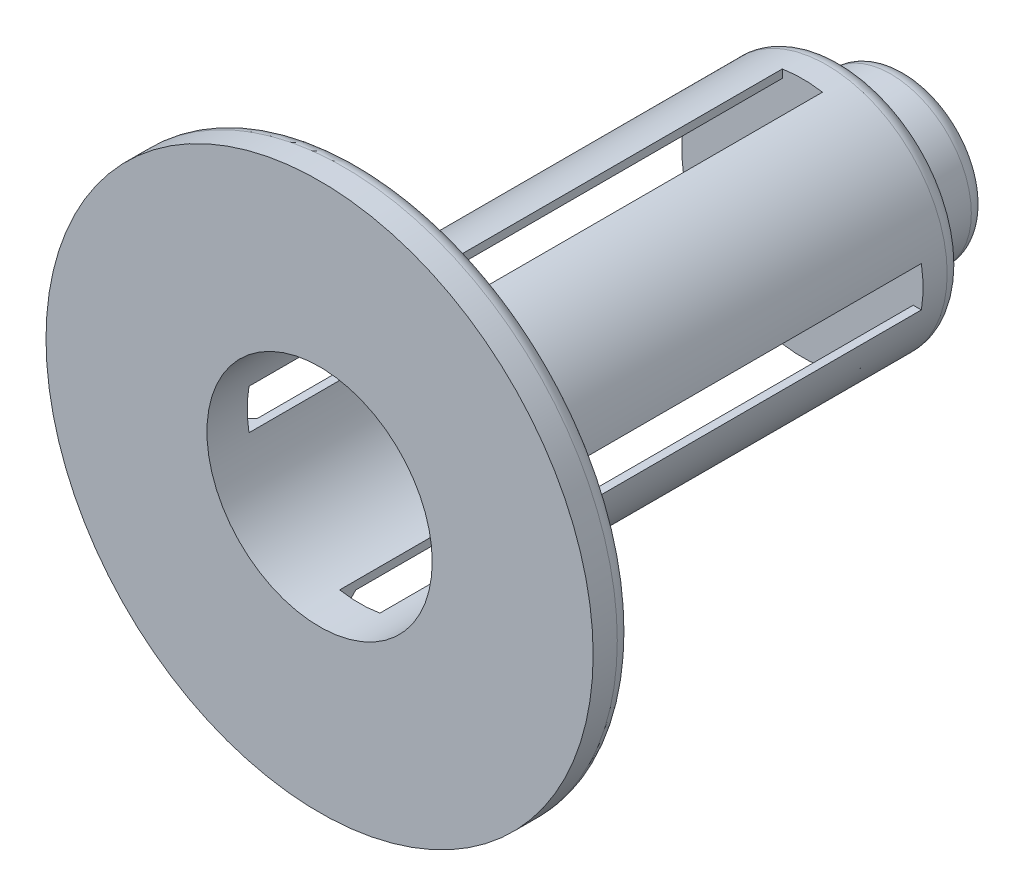
from build123d import *

# Parameters (mm, degrees)
SKETCH1_R           = 19.05
BOSS_EXTRUDE1_DEPTH = 76.2
SKETCH2_R           = 17.78
CUT_EXTRUDE1_DEPTH  = 69.85
CUT_EXTRUDE2_DEPTH  = 69.85
BOSS_EXTRUDE2_START = 6.35
SKETCH4_R           = 43.18
SKETCH4_R_2         = 17.78
BOSS_EXTRUDE2_DEPTH = 6.35
SKETCH5_R           = 12.7
BOSS_EXTRUDE3_DEPTH = 10.16
FILLET1_R           = 2.54
CHAMFER1_SIZE       = 2.54


with BuildPart() as part:
    # Sketch1 → Boss-Extrude1 (new body)
    with BuildSketch(Plane.XY):
        with Locations(Location((0, 0, 0), (0, 0, 180))):
            Circle(SKETCH1_R)
    extrude(amount=BOSS_EXTRUDE1_DEPTH)

    # Sketch2 → Cut-Extrude1 (cut)
    with BuildSketch(Plane.XY.offset(76.2)):
        Circle(SKETCH2_R)
    extrude(amount=-CUT_EXTRUDE1_DEPTH, mode=Mode.SUBTRACT)

    # Sketch3 → Cut-Extrude2 (cut)
    with BuildSketch(Plane.XY.offset(76.2)):
        with BuildLine():
            Line((-17.494221189, 3.175), (-18.783553311, 3.175))
            ThreePointArc((-18.783553311, 3.175), (-19.05, 0), (-18.783553311, -3.175))
            Line((-18.783553311, -3.175), (-17.494221189, -3.175))
            ThreePointArc((-17.494221189, -3.175), (-17.78, 0), (-17.494221189, 3.175))
        make_face()
        with BuildLine():
            ThreePointArc((19.05, 0), (18.983271459, 1.593080258), (18.783553311, 3.175))
            Line((18.783553311, 3.175), (17.494221189, 3.175))
            ThreePointArc((17.494221189, 3.175), (17.708411176, 1.593917699), (17.78, 0))
            ThreePointArc((17.78, 0), (17.708411176, -1.593917699), (17.494221189, -3.175))
            Line((17.494221189, -3.175), (18.783553311, -3.175))
            ThreePointArc((18.783553311, -3.175), (18.983271459, -1.593080258), (19.05, 0))
        make_face()
        with BuildLine():
            ThreePointArc((3.175, 18.783553311), (0, 19.05), (-3.175, 18.783553311))
            Line((-3.175, 18.783553311), (-3.175, 17.494221189))
            ThreePointArc((-3.175, 17.494221189), (0, 17.78), (3.175, 17.494221189))
            Line((3.175, 17.494221189), (3.175, 18.783553311))
        make_face()
        with BuildLine():
            Line((-3.175, -17.494221189), (-3.175, -18.783553311))
            ThreePointArc((-3.175, -18.783553311), (0, -19.05), (3.175, -18.783553311))
            Line((3.175, -18.783553311), (3.175, -17.494221189))
            ThreePointArc((3.175, -17.494221189), (0, -17.78), (-3.175, -17.494221189))
        make_face()
    extrude(amount=-CUT_EXTRUDE2_DEPTH, mode=Mode.SUBTRACT)

    # Sketch4 → Boss-Extrude2 (add)
    with BuildSketch(Plane.XY.offset(76.2).offset(BOSS_EXTRUDE2_START)):
        Circle(SKETCH4_R)
        Circle(SKETCH4_R_2, mode=Mode.SUBTRACT)
    extrude(amount=-BOSS_EXTRUDE2_DEPTH)

    # Sketch5 → Boss-Extrude3 (add)
    with BuildSketch(Plane(origin=(0, 0, 0), x_dir=(-1, 0, 0), z_dir=(0, 0, -1))):
        with Locations(Location((0, 0, 0), (0, 0, 180))):
            Circle(SKETCH5_R)
    extrude(amount=BOSS_EXTRUDE3_DEPTH)

    # Fillet1
    fillet1_edges = [part.edges().sort_by_distance(p)[0] for p in [
        (19.05, 0, 0),
        (-43.18, 0, 76.2),
        (-12.7, 0, -10.16),
    ]]
    fillet(fillet1_edges, radius=FILLET1_R)

    # Chamfer1
    # the kernel refuses this chamfer: 2.54 mm, written as the material it adds along each edge
    with BuildSketch(Plane(origin=(0, 0, 76.2), x_dir=(-0.9846344295499855, 0.1746282913641848, 0), z_dir=(0.1746282913641848, 0.9846344295499855, 0))) as chamfer1_piece_1_section:
        Polygon((19.05 + CHAMFER1_SIZE, 0), (19.05, -CHAMFER1_SIZE), (19.05, 0), align=None)
    chamfer1_piece_1 = revolve(axis=Axis((0, 0, 76.2), (0, 0, 1)), revolution_arc=110.114055389, mode=Mode.PRIVATE)
    chamfer1_piece_1 = split(chamfer1_piece_1, bisect_by=Plane(origin=(-19.847264072, 3.175, 75.490542074), z_dir=(0, 1, 0)), keep=Keep.TOP, mode=Mode.PRIVATE)
    add(chamfer1_piece_1)
    with BuildSketch(Plane(origin=(0, 0, 76.2), x_dir=(-0.9846344295499855, 0.1746282913641848, 0), z_dir=(0.1746282913641848, 0.9846344295499855, 0))) as chamfer1_piece_2_section:
        Polygon((19.05 + CHAMFER1_SIZE, 0), (19.05, -CHAMFER1_SIZE), (19.05, 0), align=None)
    chamfer1_piece_2 = revolve(axis=Axis((0, 0, 76.2), (0, 0, 1)), revolution_arc=110.114055389, mode=Mode.PRIVATE)
    chamfer1_piece_2 = split(chamfer1_piece_2, bisect_by=Plane(origin=(-14.346148442, -3.175, 74.961482306), z_dir=(0, -1, 0)), keep=Keep.TOP, mode=Mode.PRIVATE)
    chamfer1_piece_2 = split(chamfer1_piece_2, bisect_by=Plane(origin=(-3.175, -14.346148442, 74.961482306), z_dir=(-1, 0, 0)), keep=Keep.TOP, mode=Mode.PRIVATE)
    add(chamfer1_piece_2)
    with BuildSketch(Plane(origin=(0, 0, 76.2), x_dir=(-0.9846344295499855, 0.1746282913641848, 0), z_dir=(0.1746282913641848, 0.9846344295499855, 0))) as chamfer1_piece_3_section:
        Polygon((19.05 + CHAMFER1_SIZE, 0), (19.05, -CHAMFER1_SIZE), (19.05, 0), align=None)
    chamfer1_piece_3 = revolve(axis=Axis((0, 0, 76.2), (0, 0, 1)), revolution_arc=110.114055389, mode=Mode.PRIVATE)
    chamfer1_piece_3 = split(chamfer1_piece_3, bisect_by=Plane(origin=(3.175, -19.847263843, 75.490541907), z_dir=(1, 0, 0)), keep=Keep.TOP, mode=Mode.PRIVATE)
    add(chamfer1_piece_3)
    with BuildSketch(Plane(origin=(0, 0, 76.2), x_dir=(0.9846344295499821, -0.1746282913642033, 0), z_dir=(-0.1746282913642033, -0.9846344295499821, 0))) as chamfer1_piece_4_section:
        Polygon((19.05 + CHAMFER1_SIZE, 0), (19.05, -CHAMFER1_SIZE), (19.05, 0), align=None)
    chamfer1_piece_4 = revolve(axis=Axis((0, 0, 76.2), (0, 0, 1)), revolution_arc=110.114055389, mode=Mode.PRIVATE)
    chamfer1_piece_4 = split(chamfer1_piece_4, bisect_by=Plane(origin=(19.847264072, -3.175, 75.490542074), z_dir=(0, -1, 0)), keep=Keep.TOP, mode=Mode.PRIVATE)
    add(chamfer1_piece_4)
    with BuildSketch(Plane(origin=(0, 0, 76.2), x_dir=(0.9846344295499821, -0.1746282913642033, 0), z_dir=(-0.1746282913642033, -0.9846344295499821, 0))) as chamfer1_piece_5_section:
        Polygon((19.05 + CHAMFER1_SIZE, 0), (19.05, -CHAMFER1_SIZE), (19.05, 0), align=None)
    chamfer1_piece_5 = revolve(axis=Axis((0, 0, 76.2), (0, 0, 1)), revolution_arc=110.114055389, mode=Mode.PRIVATE)
    chamfer1_piece_5 = split(chamfer1_piece_5, bisect_by=Plane(origin=(14.346148442, 3.175, 74.961482306), z_dir=(0, 1, 0)), keep=Keep.TOP, mode=Mode.PRIVATE)
    chamfer1_piece_5 = split(chamfer1_piece_5, bisect_by=Plane(origin=(3.175, 14.346148442, 74.961482306), z_dir=(1, 0, 0)), keep=Keep.TOP, mode=Mode.PRIVATE)
    add(chamfer1_piece_5)
    with BuildSketch(Plane(origin=(0, 0, 76.2), x_dir=(0.9846344295499821, -0.1746282913642033, 0), z_dir=(-0.1746282913642033, -0.9846344295499821, 0))) as chamfer1_piece_6_section:
        Polygon((19.05 + CHAMFER1_SIZE, 0), (19.05, -CHAMFER1_SIZE), (19.05, 0), align=None)
    chamfer1_piece_6 = revolve(axis=Axis((0, 0, 76.2), (0, 0, 1)), revolution_arc=110.114055389, mode=Mode.PRIVATE)
    chamfer1_piece_6 = split(chamfer1_piece_6, bisect_by=Plane(origin=(-3.175, 19.847263843, 75.490541907), z_dir=(-1, 0, 0)), keep=Keep.TOP, mode=Mode.PRIVATE)
    add(chamfer1_piece_6)
    with BuildSketch(Plane(origin=(0, 0, 76.2), x_dir=(0.1746282913641894, 0.9846344295499847, 0), z_dir=(0.9846344295499847, -0.1746282913641894, 0))) as chamfer1_piece_7_section:
        Polygon((19.05 + CHAMFER1_SIZE, 0), (19.05, -CHAMFER1_SIZE), (19.05, 0), align=None)
    chamfer1_piece_7 = revolve(axis=Axis((0, 0, 76.2), (0, 0, 1)), revolution_arc=110.114055389, mode=Mode.PRIVATE)
    chamfer1_piece_7 = split(chamfer1_piece_7, bisect_by=Plane(origin=(3.175, 19.847264072, 75.490542074), z_dir=(1, 0, 0)), keep=Keep.TOP, mode=Mode.PRIVATE)
    add(chamfer1_piece_7)
    with BuildSketch(Plane(origin=(0, 0, 76.2), x_dir=(0.1746282913641894, 0.9846344295499847, 0), z_dir=(0.9846344295499847, -0.1746282913641894, 0))) as chamfer1_piece_8_section:
        Polygon((19.05 + CHAMFER1_SIZE, 0), (19.05, -CHAMFER1_SIZE), (19.05, 0), align=None)
    chamfer1_piece_8 = revolve(axis=Axis((0, 0, 76.2), (0, 0, 1)), revolution_arc=110.114055389, mode=Mode.PRIVATE)
    chamfer1_piece_8 = split(chamfer1_piece_8, bisect_by=Plane(origin=(-3.175, 14.346148442, 74.961482306), z_dir=(-1, 0, 0)), keep=Keep.TOP, mode=Mode.PRIVATE)
    chamfer1_piece_8 = split(chamfer1_piece_8, bisect_by=Plane(origin=(-14.346148442, 3.175, 74.961482306), z_dir=(0, 1, 0)), keep=Keep.TOP, mode=Mode.PRIVATE)
    add(chamfer1_piece_8)
    with BuildSketch(Plane(origin=(0, 0, 76.2), x_dir=(0.1746282913641894, 0.9846344295499847, 0), z_dir=(0.9846344295499847, -0.1746282913641894, 0))) as chamfer1_piece_9_section:
        Polygon((19.05 + CHAMFER1_SIZE, 0), (19.05, -CHAMFER1_SIZE), (19.05, 0), align=None)
    chamfer1_piece_9 = revolve(axis=Axis((0, 0, 76.2), (0, 0, 1)), revolution_arc=110.114055389, mode=Mode.PRIVATE)
    chamfer1_piece_9 = split(chamfer1_piece_9, bisect_by=Plane(origin=(-19.847263843, -3.175, 75.490541907), z_dir=(0, -1, 0)), keep=Keep.TOP, mode=Mode.PRIVATE)
    add(chamfer1_piece_9)
    with BuildSketch(Plane(origin=(0, 0, 76.2), x_dir=(-0.1746282913641849, -0.9846344295499855, 0), z_dir=(-0.9846344295499855, 0.1746282913641849, 0))) as chamfer1_piece_10_section:
        Polygon((19.05 + CHAMFER1_SIZE, 0), (19.05, -CHAMFER1_SIZE), (19.05, 0), align=None)
    chamfer1_piece_10 = revolve(axis=Axis((0, 0, 76.2), (0, 0, 1)), revolution_arc=110.114055389, mode=Mode.PRIVATE)
    chamfer1_piece_10 = split(chamfer1_piece_10, bisect_by=Plane(origin=(-3.175, -19.847264072, 75.490542074), z_dir=(-1, 0, 0)), keep=Keep.TOP, mode=Mode.PRIVATE)
    add(chamfer1_piece_10)
    with BuildSketch(Plane(origin=(0, 0, 76.2), x_dir=(-0.1746282913641849, -0.9846344295499855, 0), z_dir=(-0.9846344295499855, 0.1746282913641849, 0))) as chamfer1_piece_11_section:
        Polygon((19.05 + CHAMFER1_SIZE, 0), (19.05, -CHAMFER1_SIZE), (19.05, 0), align=None)
    chamfer1_piece_11 = revolve(axis=Axis((0, 0, 76.2), (0, 0, 1)), revolution_arc=110.114055389, mode=Mode.PRIVATE)
    chamfer1_piece_11 = split(chamfer1_piece_11, bisect_by=Plane(origin=(3.175, -14.346148442, 74.961482306), z_dir=(1, 0, 0)), keep=Keep.TOP, mode=Mode.PRIVATE)
    chamfer1_piece_11 = split(chamfer1_piece_11, bisect_by=Plane(origin=(14.346148442, -3.175, 74.961482306), z_dir=(0, -1, 0)), keep=Keep.TOP, mode=Mode.PRIVATE)
    add(chamfer1_piece_11)
    with BuildSketch(Plane(origin=(0, 0, 76.2), x_dir=(-0.1746282913641849, -0.9846344295499855, 0), z_dir=(-0.9846344295499855, 0.1746282913641849, 0))) as chamfer1_piece_12_section:
        Polygon((19.05 + CHAMFER1_SIZE, 0), (19.05, -CHAMFER1_SIZE), (19.05, 0), align=None)
    chamfer1_piece_12 = revolve(axis=Axis((0, 0, 76.2), (0, 0, 1)), revolution_arc=110.114055389, mode=Mode.PRIVATE)
    chamfer1_piece_12 = split(chamfer1_piece_12, bisect_by=Plane(origin=(19.847263843, 3.175, 75.490541907), z_dir=(0, 1, 0)), keep=Keep.TOP, mode=Mode.PRIVATE)
    add(chamfer1_piece_12)


solid = part.part
